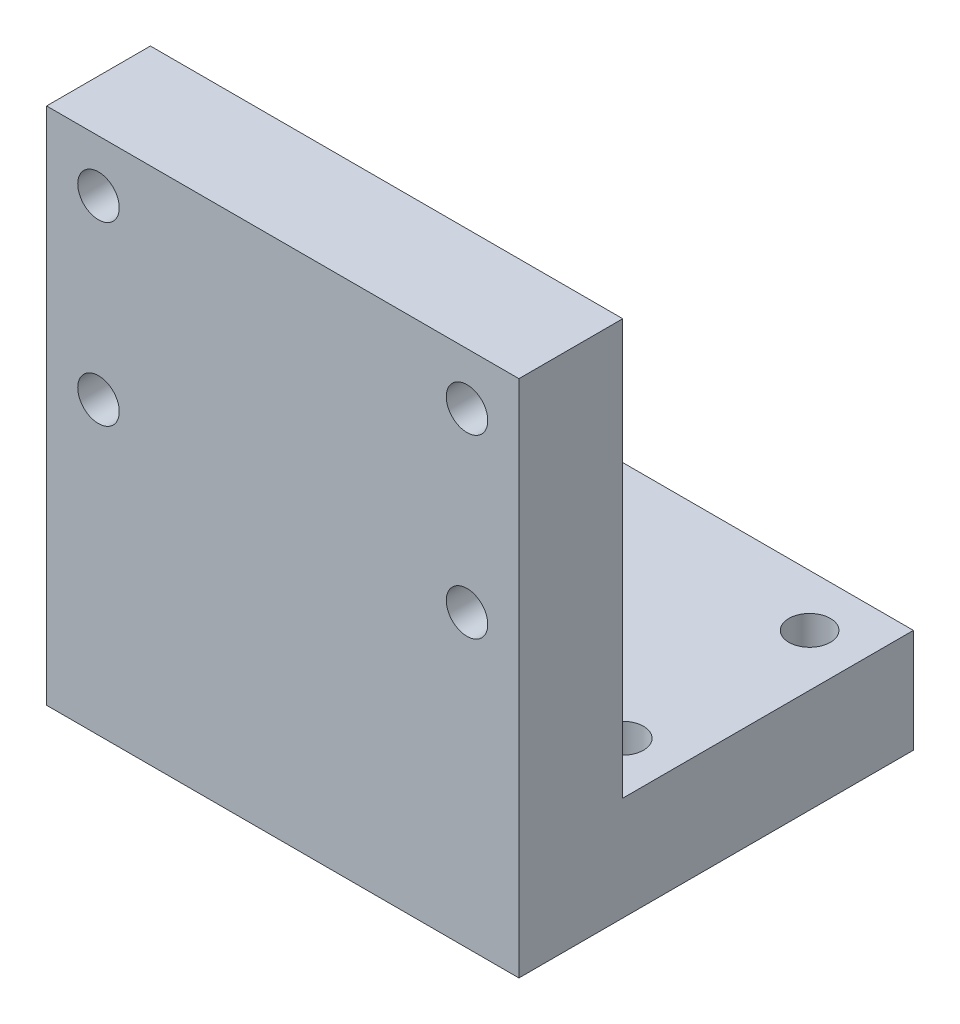
from build123d import *

# Parameters (mm, degrees)
SKETCH1_R              = 2
BASE_EXTRUSION_DEPTH   = 10
SKETCH2_R              = 3
FIRST_BASE_HOLES_DEPTH = 6
SKETCH5_W              = 45.5
SKETCH5_H              = 10
BOSS_EXTRUDE3_DEPTH    = 50
CUT_EXTRUDE2_REACH     = 63.657
SKETCH6_R              = 2
SKETCH7_R              = 3
CUT_EXTRUDE3_DEPTH     = 6


with BuildPart() as part:
    # Sketch1 → Base Extrusion (new body)
    with BuildSketch(Plane(origin=(0, 0, 0), x_dir=(1, 0, 0), z_dir=(0, 1, 0))):
        Polygon((-22.75, 14), (0, 14), (22.75, 14), (22.75, -14), (-22.75, -14), align=None)
        with Locations((-17.75, 9)):
            Circle(SKETCH1_R, mode=Mode.SUBTRACT)
        with Locations((-17.75, -9)):
            Circle(SKETCH1_R, mode=Mode.SUBTRACT)
        with Locations((17.75, 9)):
            Circle(SKETCH1_R, mode=Mode.SUBTRACT)
        with Locations((17.75, -9)):
            Circle(SKETCH1_R, mode=Mode.SUBTRACT)
    extrude(amount=BASE_EXTRUSION_DEPTH)

    # Sketch2 → First Base Holes (cut)
    with BuildSketch(Plane.XZ):
        with Locations((-17.75, 9)):
            Circle(SKETCH2_R)
        with Locations((-17.75, -9)):
            Circle(SKETCH2_R)
        with Locations((17.75, -9)):
            Circle(SKETCH2_R)
        with Locations((17.75, 9)):
            Circle(SKETCH2_R)
    extrude(amount=-FIRST_BASE_HOLES_DEPTH, mode=Mode.SUBTRACT)

    # Sketch5 → Boss-Extrude3 (add)
    with BuildSketch(Plane(origin=(0, 0, 0), x_dir=(1, 0, 0), z_dir=(0, 1, 0))):
        with Locations((0, -19)):
            Rectangle(SKETCH5_W, SKETCH5_H)
    extrude(amount=BOSS_EXTRUDE3_DEPTH)

    # Sketch6 → Cut-Extrude2 (cut, up to next)
    with BuildSketch(Plane(origin=(0, 0, 14), x_dir=(-1, 0, 0), z_dir=(0, 0, -1)), mode=Mode.PRIVATE) as cut_extrude2_sk1:
        with Locations((-17.75, 45)):
            Circle(SKETCH6_R)
    cut_extrude2_tool1 = extrude(cut_extrude2_sk1.sketch, amount=-CUT_EXTRUDE2_REACH, mode=Mode.PRIVATE) & part.part
    # Sketch6 → Cut-Extrude2 (cut, up to next)
    with BuildSketch(Plane(origin=(0, 0, 14), x_dir=(-1, 0, 0), z_dir=(0, 0, -1)), mode=Mode.PRIVATE) as cut_extrude2_sk2:
        with Locations((-17.75, 28)):
            Circle(SKETCH6_R)
    cut_extrude2_tool2 = extrude(cut_extrude2_sk2.sketch, amount=-CUT_EXTRUDE2_REACH, mode=Mode.PRIVATE) & part.part
    # Sketch6 → Cut-Extrude2 (cut, up to next)
    with BuildSketch(Plane(origin=(0, 0, 14), x_dir=(-1, 0, 0), z_dir=(0, 0, -1)), mode=Mode.PRIVATE) as cut_extrude2_sk3:
        with Locations((17.75, 45)):
            Circle(SKETCH6_R)
    cut_extrude2_tool3 = extrude(cut_extrude2_sk3.sketch, amount=-CUT_EXTRUDE2_REACH, mode=Mode.PRIVATE) & part.part
    # Sketch6 → Cut-Extrude2 (cut, up to next)
    with BuildSketch(Plane(origin=(0, 0, 14), x_dir=(-1, 0, 0), z_dir=(0, 0, -1)), mode=Mode.PRIVATE) as cut_extrude2_sk4:
        with Locations((17.75, 28)):
            Circle(SKETCH6_R)
    cut_extrude2_tool4 = extrude(cut_extrude2_sk4.sketch, amount=-CUT_EXTRUDE2_REACH, mode=Mode.PRIVATE) & part.part
    add(cut_extrude2_tool1.solids().sort_by_distance((17.75, 45, 14))[0], mode=Mode.SUBTRACT)
    add(cut_extrude2_tool2.solids().sort_by_distance((17.75, 28, 14))[0], mode=Mode.SUBTRACT)
    add(cut_extrude2_tool3.solids().sort_by_distance((-17.75, 45, 14))[0], mode=Mode.SUBTRACT)
    add(cut_extrude2_tool4.solids().sort_by_distance((-17.75, 28, 14))[0], mode=Mode.SUBTRACT)

    # Sketch7 → Cut-Extrude3 (cut)
    with BuildSketch(Plane(origin=(0, 0, 14), x_dir=(-1, 0, 0), z_dir=(0, 0, -1))):
        with Locations((-17.75, 45)):
            Circle(SKETCH7_R)
        with Locations((-17.75, 28)):
            Circle(SKETCH7_R)
        with Locations((17.75, 28)):
            Circle(SKETCH7_R)
        with Locations((17.75, 45)):
            Circle(SKETCH7_R)
    extrude(amount=-CUT_EXTRUDE3_DEPTH, mode=Mode.SUBTRACT)


solid = part.part
